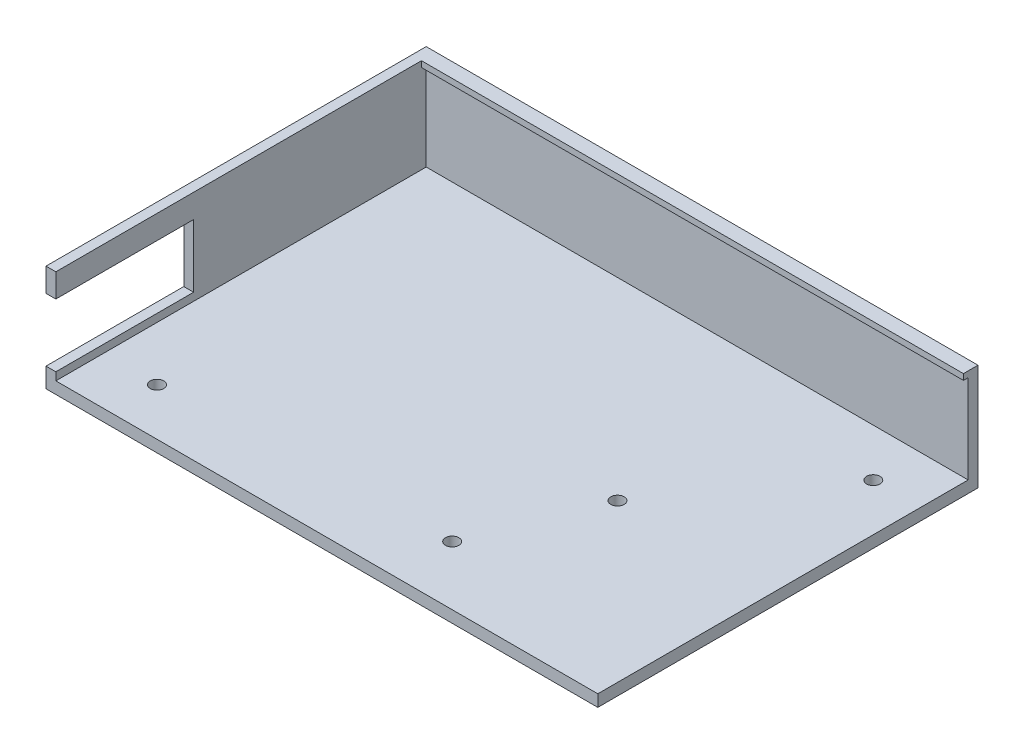
from build123d import *

# Parameters (mm, degrees)
SKETCH1_W                     = 280.4
SKETCH1_H                     = 193.2
SHELL_BLOCK_DEPTH             = 27
SKETCH2_W                     = 275.4
SKETCH2_H                     = 185.8
FRONT_OPENING_DEPTH           = 1.5
SKETCH3_W                     = 275.4
SKETCH3_H                     = 188.2
DISPLAY_POCKET_DEPTH          = 22.5
SKETCH4_W                     = 3
SKETCH4_H                     = 56
VENT_SLOTS_DEPTH              = 4
SKETCH5_W                     = 70
SKETCH5_H                     = 16
CABLE_EXIT_X_SHORT_SIDE_DEPTH = 141.2
SKETCH6_R                     = 1.7
BOLT_HOLES_DEPTH              = 4
KEEP_ONE_HALF_X_DEPTH         = 173.385034153
KEEP_ONE_HALF_X_DEPTH_BACK    = 173.385034153
SKETCH7_W                     = 200
SKETCH7_H                     = 400
KEEP_ONE_QUARTER_Z_DEPTH      = 173.385034153
KEEP_ONE_QUARTER_Z_DEPTH_BACK = 173.385034153
SKETCH8_W                     = 400
SKETCH8_H                     = 200


with BuildPart() as part:
    # Sketch1 → Shell Block (new body)
    with BuildSketch(Plane(origin=(0, 0, 0), x_dir=(1, 0, 0), z_dir=(0, 1, 0))):
        Rectangle(SKETCH1_W, SKETCH1_H)
    extrude(amount=SHELL_BLOCK_DEPTH)

    # Sketch2 → Front Opening (cut)
    with BuildSketch(Plane(origin=(0, 27, 0), x_dir=(1, 0, 0), z_dir=(0, 1, 0))):
        Rectangle(SKETCH2_W, SKETCH2_H)
    extrude(amount=-FRONT_OPENING_DEPTH, mode=Mode.SUBTRACT)

    # Sketch3 → Display Pocket (cut)
    with BuildSketch(Plane(origin=(0, 25.5, 0), x_dir=(1, 0, 0), z_dir=(0, 1, 0))):
        Rectangle(SKETCH3_W, SKETCH3_H)
    extrude(amount=-DISPLAY_POCKET_DEPTH, mode=Mode.SUBTRACT)

    # Sketch4 → Vent Slots (cut)
    with BuildSketch(Plane(origin=(0, 3, 0), x_dir=(1, 0, 0), z_dir=(0, 1, 0))):
        with Locations((67.5, 56)):
            Rectangle(SKETCH4_W, SKETCH4_H)
        with Locations((67.5, -56)):
            Rectangle(SKETCH4_W, SKETCH4_H)
        with Locations((75.5, 56)):
            Rectangle(SKETCH4_W, SKETCH4_H)
        with Locations((75.5, -56)):
            Rectangle(SKETCH4_W, SKETCH4_H)
        with Locations((83.5, 56)):
            Rectangle(SKETCH4_W, SKETCH4_H)
        with Locations((83.5, -56)):
            Rectangle(SKETCH4_W, SKETCH4_H)
        with Locations((91.5, 56)):
            Rectangle(SKETCH4_W, SKETCH4_H)
        with Locations((91.5, -56)):
            Rectangle(SKETCH4_W, SKETCH4_H)
        with Locations((99.5, 56)):
            Rectangle(SKETCH4_W, SKETCH4_H)
        with Locations((99.5, -56)):
            Rectangle(SKETCH4_W, SKETCH4_H)
        with Locations((107.5, 56)):
            Rectangle(SKETCH4_W, SKETCH4_H)
        with Locations((107.5, -56)):
            Rectangle(SKETCH4_W, SKETCH4_H)
        with Locations((115.5, 56)):
            Rectangle(SKETCH4_W, SKETCH4_H)
        with Locations((115.5, -56)):
            Rectangle(SKETCH4_W, SKETCH4_H)
        with Locations((123.5, 56)):
            Rectangle(SKETCH4_W, SKETCH4_H)
        with Locations((123.5, -56)):
            Rectangle(SKETCH4_W, SKETCH4_H)
    extrude(amount=-VENT_SLOTS_DEPTH, mode=Mode.SUBTRACT)

    # Sketch5 → Cable Exit (+X short side) (cut)
    with BuildSketch(Plane(origin=(0, 0, 0), x_dir=(0, 0, -1), z_dir=(1, 0, 0))):
        with Locations((0, 13)):
            Rectangle(SKETCH5_W, SKETCH5_H)
    extrude(amount=-CABLE_EXIT_X_SHORT_SIDE_DEPTH, mode=Mode.SUBTRACT)

    # Sketch6 → Bolt Holes (cut)
    with BuildSketch(Plane(origin=(0, 3, 0), x_dir=(1, 0, 0), z_dir=(0, 1, 0))):
        with Locations((-40, -45)):
            Circle(SKETCH6_R)
        with Locations((-40, 45)):
            Circle(SKETCH6_R)
        with Locations((40, -45)):
            Circle(SKETCH6_R)
        with Locations((40, 45)):
            Circle(SKETCH6_R)
        with Locations((-52, -15)):
            Circle(SKETCH6_R)
        with Locations((-52, 15)):
            Circle(SKETCH6_R)
        with Locations((52, -15)):
            Circle(SKETCH6_R)
        with Locations((52, 15)):
            Circle(SKETCH6_R)
        with Locations((-12, -82)):
            Circle(SKETCH6_R)
        with Locations((-12, 82)):
            Circle(SKETCH6_R)
        with Locations((12, -82)):
            Circle(SKETCH6_R)
        with Locations((12, 82)):
            Circle(SKETCH6_R)
        with Locations((-124, -12)):
            Circle(SKETCH6_R)
        with Locations((-124, 12)):
            Circle(SKETCH6_R)
        with Locations((124, -12)):
            Circle(SKETCH6_R)
        with Locations((124, 12)):
            Circle(SKETCH6_R)
    extrude(amount=-BOLT_HOLES_DEPTH, mode=Mode.SUBTRACT)

    # Sketch7 → Keep one half (X) (cut, two sides: drawn at the far end of the back side and taken through both)
    with BuildSketch(Plane(origin=(0, 0, 0), x_dir=(1, 0, 0), z_dir=(0, 1, 0)).offset(-KEEP_ONE_HALF_X_DEPTH_BACK)):
        with Locations((100, 0)):
            Rectangle(SKETCH7_W, SKETCH7_H)
    extrude(amount=KEEP_ONE_HALF_X_DEPTH + KEEP_ONE_HALF_X_DEPTH_BACK, mode=Mode.SUBTRACT)

    # Sketch8 → Keep one quarter (Z) (cut, two sides: drawn at the far end of the back side and taken through both)
    with BuildSketch(Plane(origin=(0, 0, 0), x_dir=(1, 0, 0), z_dir=(0, 1, 0)).offset(-KEEP_ONE_QUARTER_Z_DEPTH_BACK)):
        with Locations((0, -100)):
            Rectangle(SKETCH8_W, SKETCH8_H)
    extrude(amount=KEEP_ONE_QUARTER_Z_DEPTH + KEEP_ONE_QUARTER_Z_DEPTH_BACK, mode=Mode.SUBTRACT)


solid = part.part
